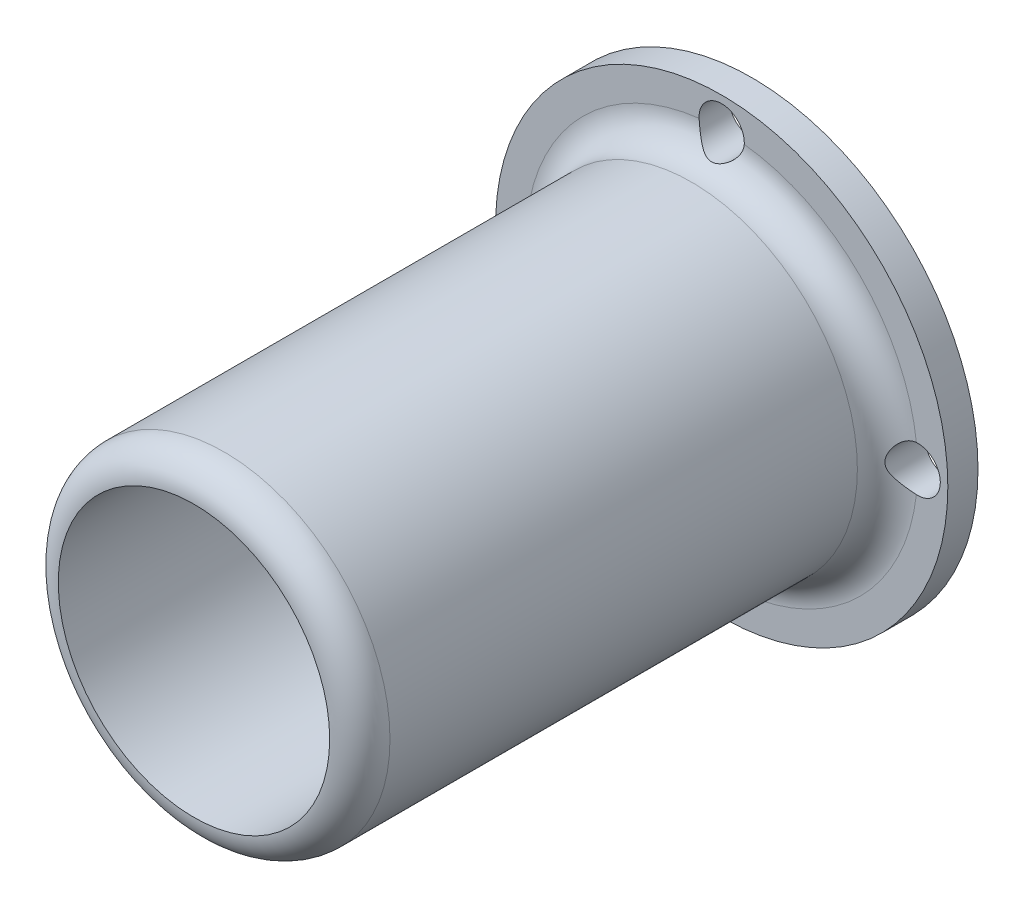
from build123d import *

# Parameters (mm, degrees)
SKETCH1_R           = 15
BOSS_EXTRUDE1_DEPTH = 2
SKETCH2_R           = 11
SKETCH2_R_2         = 9
BOSS_EXTRUDE2_DEPTH = 35
SKETCH3_R           = 1.5
CUT_EXTRUDE1_DEPTH  = 41.926763859
FILLET1_R           = 2
FILLET2_R           = 2


with BuildPart() as part:
    # Sketch1 → Boss-Extrude1 (new body)
    with BuildSketch(Plane.XY):
        Circle(SKETCH1_R)
    extrude(amount=BOSS_EXTRUDE1_DEPTH)

    # Sketch2 → Boss-Extrude2 (add)
    with BuildSketch(Plane.XY.offset(2)):
        Circle(SKETCH2_R)
        Circle(SKETCH2_R_2, mode=Mode.SUBTRACT)
    extrude(amount=BOSS_EXTRUDE2_DEPTH)

    # Sketch3 → Cut-Extrude1 (cut, through all)
    with BuildSketch(Plane.XY.offset(2)):
        with Locations((0, 13)):
            Circle(SKETCH3_R)
        with Locations((13, 0)):
            Circle(SKETCH3_R)
        with Locations((0, -13)):
            Circle(SKETCH3_R)
        with Locations((-13, 0)):
            Circle(SKETCH3_R)
    extrude(amount=-CUT_EXTRUDE1_DEPTH, mode=Mode.SUBTRACT)

    # Fillet1
    # the kernel refuses this fillet: 2 mm, written as the material it adds along each edge
    with BuildSketch(Plane(origin=(0, 0, 2), x_dir=(1, 0, 0), z_dir=(0, -1, 0))) as fillet1_piece_1_section:
        with BuildLine():
            CenterArc((11 + FILLET1_R, FILLET1_R), FILLET1_R, 180, 90)
            Line((11, FILLET1_R), (11, 0))
            Line((11, 0), (11 + FILLET1_R, 0))
        make_face()
    fillet1_piece_1 = revolve(axis=Axis((0, 0, 2), (0, 0, 1)), mode=Mode.PRIVATE)
    fillet1_piece_1 = fillet1_piece_1 - Plane(origin=(-13, 0, 2.02819371), x_dir=(1, 0, 0), z_dir=(0, 0, 1)) * Cylinder(1.5, 52, mode=Mode.PRIVATE)
    fillet1_piece_1 = fillet1_piece_1 - Plane(origin=(0, -13, 2.02819371), x_dir=(1, 0, 0), z_dir=(0, 0, 1)) * Cylinder(1.5, 52, mode=Mode.PRIVATE)
    fillet1_piece_1 = fillet1_piece_1 - Plane(origin=(13, 0, 2.02819371), x_dir=(1, 0, 0), z_dir=(0, 0, 1)) * Cylinder(1.5, 52, mode=Mode.PRIVATE)
    fillet1_piece_1 = fillet1_piece_1 - Plane(origin=(0, 13, 2.02819371), x_dir=(1, 0, 0), z_dir=(0, 0, 1)) * Cylinder(1.5, 52, mode=Mode.PRIVATE)
    add(fillet1_piece_1)
    # the kernel refuses this fillet: 2 mm, written as the material it takes off along each edge
    with BuildSketch(Plane(origin=(0, 0, 37), x_dir=(1, 0, 0), z_dir=(0, -1, 0))) as fillet1_2_piece_1:
        with BuildLine():
            CenterArc((11 - FILLET1_R, -FILLET1_R), FILLET1_R, 0, 90)
            Line((11 - FILLET1_R, 0), (11, 0))
            Line((11, 0), (11, -FILLET1_R))
        make_face()
    revolve(axis=Axis((0, 0, 37), (0, 0, 1)), mode=Mode.SUBTRACT)

    # Fillet2
    fillet2_edges = [part.edges().sort_by_distance(p)[0] for p in [
        (-9, 0, 2),
    ]]
    fillet(fillet2_edges, radius=FILLET2_R)


solid = part.part
